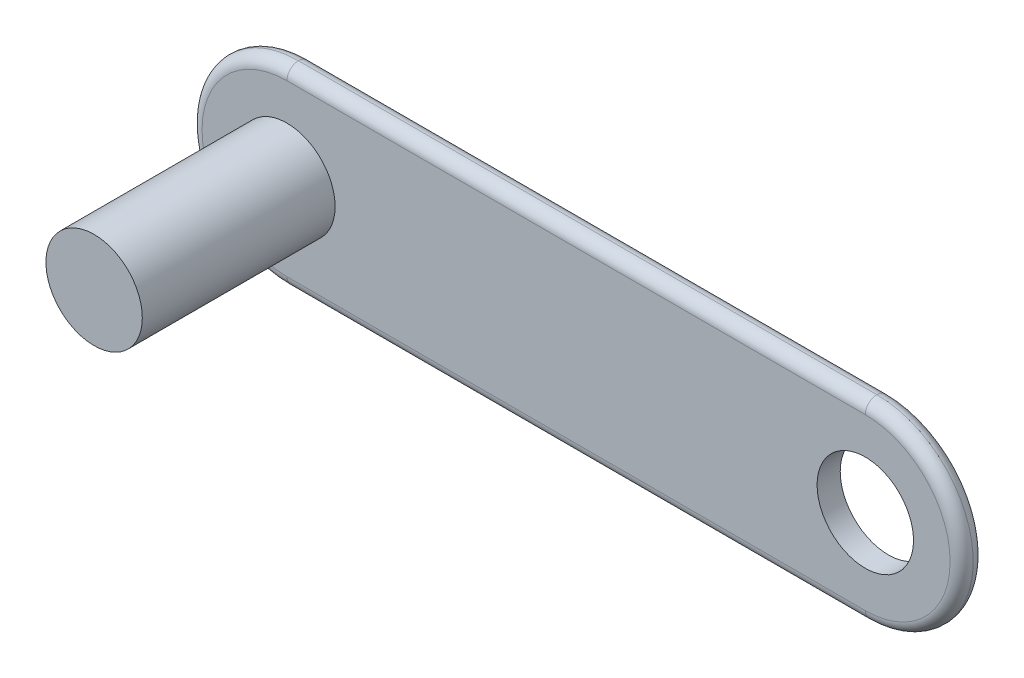
from build123d import *

# Parameters (mm, degrees)
BOSS_EXTRUDE1_DEPTH     = 1.524
CUT_EXTRUDE1_DEPTH      = 3.048
CUT_EXTRUDE1_DEPTH_BACK = 90.815491849
SKETCH2_R               = 6.35
SKETCH4_R               = 6.35
BOSS_EXTRUDE3_DEPTH     = 25.4
FILLET1_R               = 1.524


with BuildPart() as part:
    # Sketch1 → Boss-Extrude1 (new, symmetric)
    with BuildSketch(Plane.XY):
        with BuildLine():
            Line((0, 12.7), (76.2, 12.7))
            ThreePointArc((76.2, 12.7), (88.9, 0), (76.2, -12.7))
            Line((76.2, -12.7), (0, -12.7))
            ThreePointArc((0, -12.7), (-12.7, 0), (0, 12.7))
        make_face()
    extrude(amount=BOSS_EXTRUDE1_DEPTH, both=True)

    # Sketch2 → Cut-Extrude1 (cut, two sides: drawn at the far end of the back side and taken through both)
    with BuildSketch(Plane.XY.offset(-CUT_EXTRUDE1_DEPTH_BACK)):
        with Locations(Location((76.2, 0, 0), (0, 0, 180))):
            Circle(SKETCH2_R)
    extrude(amount=CUT_EXTRUDE1_DEPTH + CUT_EXTRUDE1_DEPTH_BACK, mode=Mode.SUBTRACT)

    # Sketch4 → Boss-Extrude3 (add)
    with BuildSketch(Plane.XY.offset(1.524)):
        Circle(SKETCH4_R)
    extrude(amount=BOSS_EXTRUDE3_DEPTH)

    # Fillet1
    fillet1_edges = [part.edges().sort_by_distance(p)[0] for p in [
        (88.9, 0, 1.524),
        (38.1, -12.7, 1.524),
        (-12.7, 0, 1.524),
        (88.9, 0, -1.524),
        (38.1, -12.7, -1.524),
        (-12.7, 0, -1.524),
        (38.1, 12.7, 1.524),
        (38.1, 12.7, -1.524),
    ]]
    fillet(fillet1_edges, radius=FILLET1_R - 0.0001)  # a hair under: the kernel refuses the full size


solid = part.part
